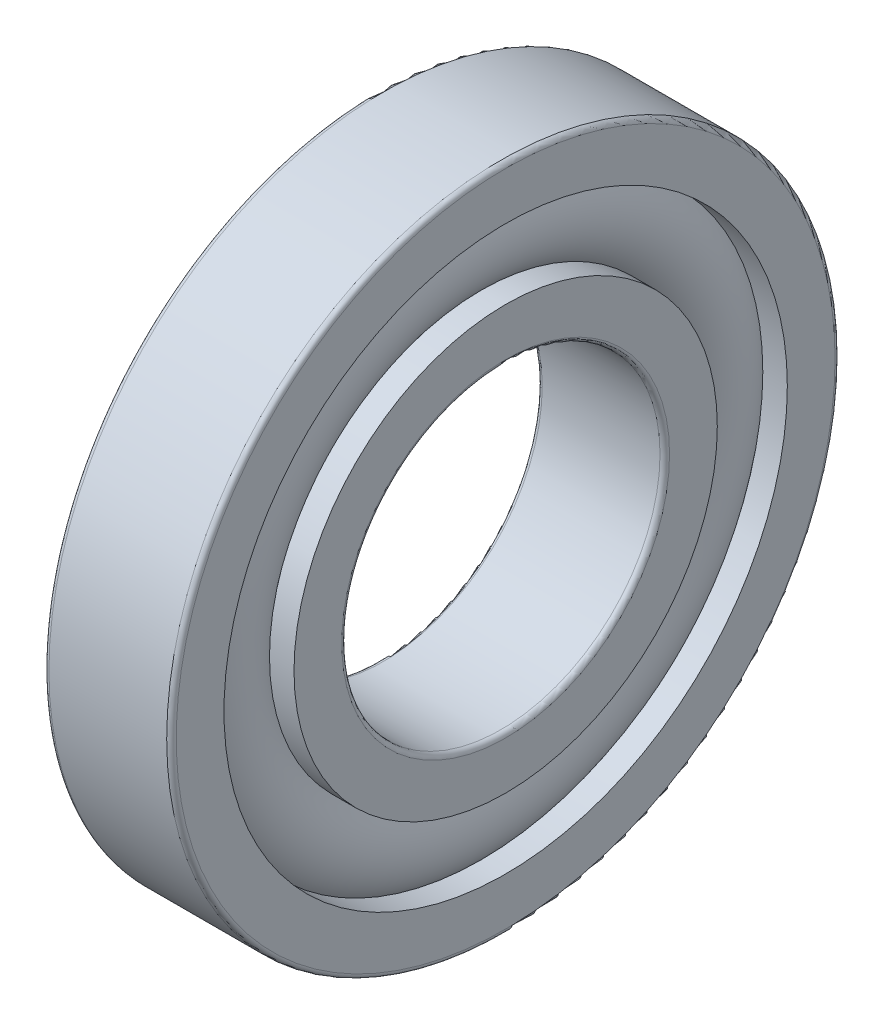
from build123d import *

# Parameters (mm, degrees)
CAGSPISKE_W = 0.66
CAGSPISKE_H = 1.1
BALSIMSKE_R = 3.3


with BuildPart() as part:
    # CagSpiSke → CageSpine (revolve)
    with BuildSketch(Plane.XY):
        with Locations((0, 15.5)):
            Rectangle(CAGSPISKE_W, CAGSPISKE_H)
    revolve(axis=Axis((-20.6375, 0, 0), (1, 0, 0)))

    # BalSimSke → BallsSimplified (revolve)
    with BuildSketch(Plane.XY):
        with Locations((0, 15.5)):
            Circle(BALSIMSKE_R)
    revolve(axis=Axis((-10, 0, 0), (1, 0, 0)))

    # InnRacSke → InnerRace (revolve)
    with BuildSketch(Plane.XY):
        with BuildLine():
            Line((-2.426030709, 13.3), (-4, 13.3))
            Line((-4, 13.3), (-4, 10.3))
            ThreePointArc((-4, 10.3), (-3.912132034, 10.087867966), (-3.7, 10))
            Line((-3.7, 10), (3.7, 10))
            ThreePointArc((3.7, 10), (3.912132034, 10.087867966), (4, 10.3))
            Line((4, 10.3), (4, 13.3))
            Line((4, 13.3), (2.426030709, 13.3))
            ThreePointArc((2.426030709, 13.3), (0, 12.225), (-2.426030709, 13.3))
        make_face()
    revolve(axis=Axis((-20.6375, 0, 0), (1, 0, 0)))

    # OutRacSke → OuterRace (revolve)
    with BuildSketch(Plane.XY):
        with BuildLine():
            Line((-2.426030709, 17.7), (-4, 17.7))
            Line((-4, 17.7), (-4, 20.7))
            ThreePointArc((-4, 20.7), (-3.912132034, 20.912132034), (-3.7, 21))
            Line((-3.7, 21), (3.7, 21))
            ThreePointArc((3.7, 21), (3.912132034, 20.912132034), (4, 20.7))
            Line((4, 20.7), (4, 17.7))
            Line((4, 17.7), (2.426030709, 17.7))
            ThreePointArc((2.426030709, 17.7), (0, 18.775), (-2.426030709, 17.7))
        make_face()
    revolve(axis=Axis((-20.6375, 0, 0), (1, 0, 0)))


solid = part.part
